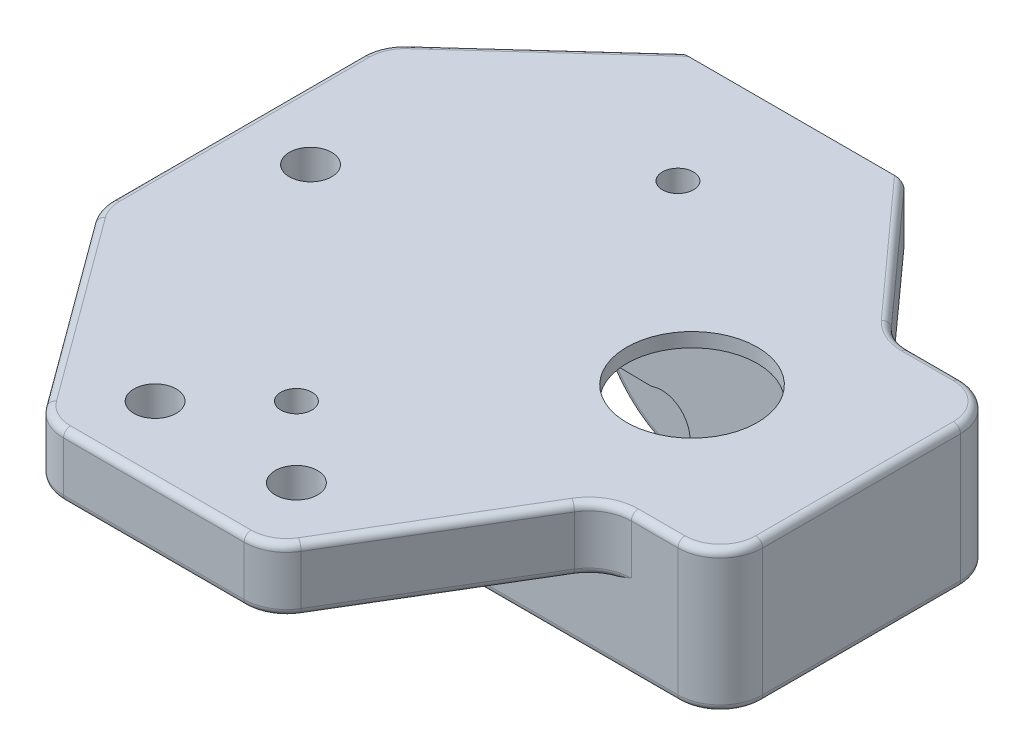
from build123d import *

# Parameters (mm, degrees)
BOSS_EXTRUDE1_DEPTH     = 4.5
SKETCH2_W               = 34
SKETCH2_H               = 20
BOSS_EXTRUDE2_DEPTH     = 5.5
SKETCH3_R               = 4.621656239
CUT_EXTRUDE1_DEPTH      = 15.5
SKETCH4_W               = 22.4
SKETCH4_H               = 12.6
CUT_EXTRUDE2_DEPTH      = 9
SKETCH5_R               = 1.5
CUT_EXTRUDE3_DEPTH      = 9
SKETCH6_R               = 1
CUT_EXTRUDE4_DEPTH      = 9
SKETCH7_R               = 1.5
CUT_EXTRUDE5_DEPTH      = 19
SKETCH8_W               = 16
SKETCH8_H               = 5
BOSS_EXTRUDE3_DEPTH     = 15
SKETCH9_R               = 0.75
CUT_EXTRUDE6_DEPTH      = 6
SKETCH10_R              = 2
CUT_EXTRUDE7_DEPTH      = 36
FILLET1_R               = 3
FILLET2_R               = 8
FILLET3_R               = 2
CUT_EXTRUDE8_DEPTH      = 30
CUT_EXTRUDE9_DEPTH      = 10
CUT_EXTRUDE9_DEPTH_BACK = 10
SKETCH12_R              = 1.1
FILLET4_R               = 0.5
SKETCH13_R              = 2
CUT_EXTRUDE10_DEPTH     = 10


# Some blends are built 0.0001 mm under size
with BuildPart() as part:
    # Sketch1 → Boss-Extrude1 (new body)
    with BuildSketch(Plane(origin=(0, 0, 0), x_dir=(1, 0, 0), z_dir=(0, 1, 0))):
        Polygon((0, 0), (16, 0), (25, 15), (33, 15), (33, 35), (25, 35), (16, 45), (0, 45), (-11, 35), (-11, 15), align=None)
    extrude(amount=BOSS_EXTRUDE1_DEPTH)

    # Sketch2 → Boss-Extrude2 (add)
    with BuildSketch(Plane(origin=(0, 0, 0), x_dir=(-1, 0, 0), z_dir=(0, -1, 0))):
        with Locations((-16, 25)):
            Rectangle(SKETCH2_W, SKETCH2_H)
    extrude(amount=BOSS_EXTRUDE2_DEPTH)

    # Sketch3 → Cut-Extrude1 (cut)
    with BuildSketch(Plane(origin=(0, -5.5, 0), x_dir=(-1, 0, 0), z_dir=(0, -1, 0))):
        with Locations(Location((-21, 25, 0), (0, 0, 90))):
            Circle(SKETCH3_R)
    extrude(amount=-CUT_EXTRUDE1_DEPTH, mode=Mode.SUBTRACT)

    # Sketch4 → Cut-Extrude2 (cut)
    with BuildSketch(Plane.XZ.offset(5.5)):
        with Locations((15.8, -24.8)):
            Rectangle(SKETCH4_W, SKETCH4_H)
    extrude(amount=-CUT_EXTRUDE2_DEPTH, mode=Mode.SUBTRACT)

    # Sketch5 → Cut-Extrude3 (cut)
    with BuildSketch(Plane(origin=(0, 0, 0), x_dir=(-1, 0, 0), z_dir=(0, -1, 0))):
        with Locations(Location((-3, 5, 0), (0, 0, 90))):
            Circle(SKETCH5_R)
        with Locations(Location((-13, 5, 0), (0, 0, 90))):
            Circle(SKETCH5_R)
    extrude(amount=-CUT_EXTRUDE3_DEPTH, mode=Mode.SUBTRACT)

    # Sketch6 → Cut-Extrude4 (cut)
    with BuildSketch(Plane(origin=(0, -5.5, 0), x_dir=(-1, 0, 0), z_dir=(0, -1, 0))):
        with Locations(Location((-2, 25, 0), (0, 0, 90))):
            Circle(SKETCH6_R)
        with Locations(Location((-30, 25, 0), (0, 0, 90))):
            Circle(SKETCH6_R)
    extrude(amount=-CUT_EXTRUDE4_DEPTH, mode=Mode.SUBTRACT)

    # Sketch7 → Cut-Extrude5 (cut)
    with BuildSketch(Plane(origin=(0, 0, 0), x_dir=(-1, 0, 0), z_dir=(0, -1, 0))):
        with Locations(Location((6, 25, 0), (0, 0, 90))):
            Circle(SKETCH7_R)
    extrude(amount=-CUT_EXTRUDE5_DEPTH, mode=Mode.SUBTRACT)

    # Sketch8 → Boss-Extrude3 (add)
    with BuildSketch(Plane(origin=(0, 0, 0), x_dir=(-1, 0, 0), z_dir=(0, -1, 0))):
        with Locations((-8, 41.5)):
            Rectangle(SKETCH8_W, SKETCH8_H)
    extrude(amount=BOSS_EXTRUDE3_DEPTH)

    # Sketch9 → Cut-Extrude6 (cut)
    with BuildSketch(Plane(origin=(0, 0, -45), x_dir=(-1, 0, 0), z_dir=(0, 0, -1))):
        with Locations((-12.75, -5)):
            Circle(SKETCH9_R)
        with Locations((-3.25, -5)):
            Circle(SKETCH9_R)
    extrude(amount=-CUT_EXTRUDE6_DEPTH, mode=Mode.SUBTRACT)

    # Sketch10 → Cut-Extrude7 (cut)
    with BuildSketch(Plane(origin=(0, 0, -45), x_dir=(-1, 0, 0), z_dir=(0, 0, -1))):
        with Locations((-8, -5)):
            Circle(SKETCH10_R)
    extrude(amount=-CUT_EXTRUDE7_DEPTH, mode=Mode.SUBTRACT)

    # Fillet1
    fillet1_edges = [part.edges().sort_by_distance(p)[0] for p in [
        (-11, 2.25, -15),
        (-11, 2.25, -35),
        (25, 2.25, -35),
        (33, -0.5, -35),
        (33, -0.5, -15),
        (25, 2.25, -15),
        (16, 2.25, 0),
        (0, 2.25, 0),
        (-1, -2.75, -15),
        (-1, -2.75, -35),
    ]]
    fillet(fillet1_edges, radius=FILLET1_R)

    # Fillet2
    fillet2_edges = [part.edges().sort_by_distance(p)[0] for p in [
        (16, -15, -41.5),
        (0, -15, -41.5),
    ]]
    fillet(fillet2_edges, radius=FILLET2_R - 0.0001)  # a hair under: the kernel refuses the full size

    # Fillet3
    fillet3_edges = [part.edges().sort_by_distance(p)[0] for p in [
        (8, 0, -39),
    ]]
    fillet(fillet3_edges, radius=FILLET3_R)

    # Sketch11 → Cut-Extrude8 (cut)
    with BuildSketch(Plane.XY.offset(-39)):
        with BuildLine():
            Line((3.25, -3), (12.041449094, -3.129717772))
            ThreePointArc((12.041449094, -3.129717772), (14.75, -5), (12.041449094, -6.870282228))
            Line((12.041449094, -6.870282228), (3.25, -7))
            ThreePointArc((3.25, -7), (1.25, -5), (3.25, -3))
        make_face()
    extrude(amount=CUT_EXTRUDE8_DEPTH, mode=Mode.SUBTRACT)

    # Sketch12 → Cut-Extrude9 (cut, two sides: drawn at the far end of the back side and taken through both)
    with BuildSketch(Plane(origin=(0, 0, 0), x_dir=(-1, 0, 0), z_dir=(0, -1, 0)).offset(-CUT_EXTRUDE9_DEPTH_BACK)):
        with Locations(Location((-8, 37, 0), (0, 0, 180))):
            Circle(SKETCH12_R)
        with Locations(Location((-8, 10, 0), (0, 0, 90))):
            Circle(SKETCH12_R)
    extrude(amount=CUT_EXTRUDE9_DEPTH + CUT_EXTRUDE9_DEPTH_BACK, mode=Mode.SUBTRACT)

    # Fillet4
    # the kernel refuses this fillet: 0.5 mm, written as the material it takes off along each edge
    with BuildSketch(Plane(origin=(0.924925092, 4.5, -45.840840992), x_dir=(0, -1, 0), z_dir=(-0.7399400733959434, 0, 0.6726727939963129)), Plane(origin=(0.924925092, 0, -45.840840992), x_dir=(0.6726727939963129, 0, 0.7399400733959434), z_dir=(-0.7399400733959434, 0, 0.6726727939963129))) as fillet4_piece_1:
        with BuildLine():
            CenterArc((FILLET4_R, FILLET4_R), FILLET4_R, 180, 90)
            Line((0, FILLET4_R), (0, 0))
            Line((0, 0), (FILLET4_R, 0))
        make_face()
    extrude(amount=14.788959089, mode=Mode.SUBTRACT)
    with BuildSketch(Plane(origin=(-8, 4.5, -33.672890342), x_dir=(-0.6726727939963135, 0, -0.7399400733959428), z_dir=(0.7399400733959428, 0, -0.6726727939963135))) as fillet4_piece_2:
        with BuildLine():
            CenterArc((3 - FILLET4_R, -FILLET4_R), FILLET4_R, 0, 90)
            Line((3 - FILLET4_R, 0), (3, 0))
            Line((3, 0), (3, -FILLET4_R))
        make_face()
    revolve(axis=Axis((-8, 4.5, -33.672890342), (0, 1, 0)), revolution_arc=47.726310994, mode=Mode.SUBTRACT)
    with BuildSketch(Plane(origin=(-11, 4.5, -33.672890342), x_dir=(0, -1, 0), z_dir=(0, 0, 1)), Plane(origin=(-11, 0, -33.672890342), x_dir=(1, 0, 0), z_dir=(0, 0, 1))) as fillet4_piece_3:
        with BuildLine():
            CenterArc((FILLET4_R, FILLET4_R), FILLET4_R, 180, 90)
            Line((0, FILLET4_R), (0, 0))
            Line((0, 0), (FILLET4_R, 0))
        make_face()
    extrude(amount=17.690778913, mode=Mode.SUBTRACT)
    with BuildSketch(Plane(origin=(-8, 4.5, -15.982111428), x_dir=(-1, 0, 0), z_dir=(0, 0, -1))) as fillet4_piece_4:
        with BuildLine():
            CenterArc((3 - FILLET4_R, -FILLET4_R), FILLET4_R, 0, 90)
            Line((3 - FILLET4_R, 0), (3, 0))
            Line((3, 0), (3, -FILLET4_R))
        make_face()
    revolve(axis=Axis((-8, 4.5, -15.982111428), (0, 1, 0)), revolution_arc=36.253837737, mode=Mode.SUBTRACT)
    with BuildSketch(Plane(origin=(-10.419214988, 4.5, -14.208020438), x_dir=(0, -1, 0), z_dir=(0.5913636636275179, 0, 0.8064049958557052)), Plane(origin=(-10.419214988, 0, -14.208020438), x_dir=(0.8064049958557051, 0, -0.5913636636275179), z_dir=(0.5913636636275179, 0, 0.8064049958557052))) as fillet4_piece_5:
        with BuildLine():
            CenterArc((FILLET4_R, FILLET4_R), FILLET4_R, 180, 90)
            Line((0, FILLET4_R), (0, 0))
            Line((0, 0), (FILLET4_R, 0))
        make_face()
    extrude(amount=16.098748762, mode=Mode.SUBTRACT)
    with BuildSketch(Plane(origin=(1.520215048, 4.5, -3), x_dir=(0, 0, 1), z_dir=(1, 0, 0))) as fillet4_piece_6:
        with BuildLine():
            CenterArc((3 - FILLET4_R, FILLET4_R), FILLET4_R, 270, 90)
            Line((3 - FILLET4_R, 0), (3, 0))
            Line((3, 0), (3, FILLET4_R))
        make_face()
    revolve(axis=Axis((1.520215048, 4.5, -3), (0, -1, 0)), revolution_arc=53.746162263, mode=Mode.SUBTRACT)
    with BuildSketch(Plane(origin=(1.520215048, 4.5, 0), x_dir=(0, -1, 0), z_dir=(1, 0, 0)), Plane(origin=(1.520215048, 0, 0), x_dir=(0, 0, -1), z_dir=(1, 0, 0))) as fillet4_piece_7:
        with BuildLine():
            CenterArc((FILLET4_R, FILLET4_R), FILLET4_R, 180, 90)
            Line((0, FILLET4_R), (0, 0))
            Line((0, 0), (FILLET4_R, 0))
        make_face()
    extrude(amount=12.781213816, mode=Mode.SUBTRACT)
    with BuildSketch(Plane(origin=(14.301428863, 4.5, -3), x_dir=(0, 0, 1), z_dir=(-1, 0, 0))) as fillet4_piece_8:
        with BuildLine():
            CenterArc((3 - FILLET4_R, -FILLET4_R), FILLET4_R, 0, 90)
            Line((3 - FILLET4_R, 0), (3, 0))
            Line((3, 0), (3, -FILLET4_R))
        make_face()
    revolve(axis=Axis((14.301428863, 4.5, -3), (0, 1, 0)), revolution_arc=59.036243468, mode=Mode.SUBTRACT)
    with BuildSketch(Plane(origin=(16.87390764, 4.5, -1.456512734), x_dir=(0, -1, 0), z_dir=(0.5144957554275266, 0, -0.8574929257125442)), Plane(origin=(16.87390764, 0, -1.456512734), x_dir=(-0.8574929257125441, 0, -0.5144957554275266), z_dir=(0.5144957554275266, 0, -0.8574929257125442))) as fillet4_piece_9:
        with BuildLine():
            CenterArc((FILLET4_R, FILLET4_R), FILLET4_R, 180, 90)
            Line((0, FILLET4_R), (0, 0))
            Line((0, 0), (FILLET4_R, 0))
        make_face()
    extrude(amount=14.095713411, mode=Mode.SUBTRACT)
    with BuildSketch(Plane(origin=(26.698571137, 4.5, -12), x_dir=(0, 0, -1), z_dir=(1, 0, 0))) as fillet4_piece_10:
        with BuildLine():
            CenterArc((3 + FILLET4_R, -FILLET4_R), FILLET4_R, 90, 90)
            Line((3 + FILLET4_R, 0), (3, 0))
            Line((3, 0), (3, -FILLET4_R))
        make_face()
    revolve(axis=Axis((26.698571137, 4.5, -12), (0, 1, 0)), revolution_arc=59.036243468, mode=Mode.SUBTRACT)
    with BuildSketch(Plane(origin=(26.698571137, 4.5, -15), x_dir=(0, -1, 0), z_dir=(1, 0, 0))) as fillet4_piece_11:
        with BuildLine():
            CenterArc((FILLET4_R, FILLET4_R), FILLET4_R, 180, 90)
            Line((0, FILLET4_R), (0, 0))
            Line((0, 0), (FILLET4_R, 0))
        make_face()
    extrude(amount=3.301428863, mode=Mode.SUBTRACT)
    with BuildSketch(Plane(origin=(30, 4.5, -18), x_dir=(1, 0, 0), z_dir=(0, 0, -1))) as fillet4_piece_12:
        with BuildLine():
            CenterArc((3 - FILLET4_R, FILLET4_R), FILLET4_R, 270, 90)
            Line((3, FILLET4_R), (3, 0))
            Line((3, 0), (3 - FILLET4_R, 0))
        make_face()
    revolve(axis=Axis((30, 4.5, -18), (0, -1, 0)), revolution_arc=90, mode=Mode.SUBTRACT)
    with BuildSketch(Plane(origin=(33, 4.5, -18), x_dir=(-1, 0, 0), z_dir=(0, 0, -1)), Plane(origin=(33, -5.5, -32), x_dir=(-1, 0, 0), z_dir=(0, 0, 1))) as fillet4_piece_13:
        with BuildLine():
            CenterArc((FILLET4_R, -FILLET4_R), FILLET4_R, 90, 90)
            Line((0, -FILLET4_R), (0, 0))
            Line((0, 0), (FILLET4_R, 0))
        make_face()
    extrude(amount=14, mode=Mode.SUBTRACT)
    with BuildSketch(Plane(origin=(30, 4.5, -32), x_dir=(0, 0, -1), z_dir=(-1, 0, 0))) as fillet4_piece_14:
        with BuildLine():
            CenterArc((3 - FILLET4_R, FILLET4_R), FILLET4_R, 270, 90)
            Line((3, FILLET4_R), (3, 0))
            Line((3, 0), (3 - FILLET4_R, 0))
        make_face()
    revolve(axis=Axis((30, 4.5, -32), (0, -1, 0)), revolution_arc=90, mode=Mode.SUBTRACT)
    with BuildSketch(Plane(origin=(30, 4.5, -35), x_dir=(0, -1, 0), z_dir=(-1, 0, 0))) as fillet4_piece_15:
        with BuildLine():
            CenterArc((FILLET4_R, FILLET4_R), FILLET4_R, 180, 90)
            Line((0, FILLET4_R), (0, 0))
            Line((0, 0), (FILLET4_R, 0))
        make_face()
    extrude(amount=3.663912786, mode=Mode.SUBTRACT)
    with BuildSketch(Plane(origin=(26.336087214, 4.5, -38), x_dir=(-0.7432941462471643, 0, 0.6689647316224518), z_dir=(-0.6689647316224518, 0, -0.7432941462471643))) as fillet4_piece_16:
        with BuildLine():
            CenterArc((3 + FILLET4_R, -FILLET4_R), FILLET4_R, 90, 90)
            Line((3 + FILLET4_R, 0), (3, 0))
            Line((3, 0), (3, -FILLET4_R))
        make_face()
    revolve(axis=Axis((26.336087214, 4.5, -38), (0, 1, 0)), revolution_arc=48.012787504, mode=Mode.SUBTRACT)
    with BuildSketch(Plane(origin=(24.106204775, 4.5, -35.993105805), x_dir=(0, -1, 0), z_dir=(-0.6689647316224511, 0, -0.7432941462471652)), Plane(origin=(24.106204775, 0, -35.993105805), x_dir=(-0.7432941462471652, 0, 0.6689647316224511), z_dir=(-0.6689647316224511, 0, -0.7432941462471652))) as fillet4_piece_17:
        with BuildLine():
            CenterArc((FILLET4_R, FILLET4_R), FILLET4_R, 180, 90)
            Line((0, FILLET4_R), (0, 0))
            Line((0, 0), (FILLET4_R, 0))
        make_face()
    extrude(amount=13.367536833, mode=Mode.SUBTRACT)
    with BuildSketch(Plane(origin=(-8, 0, -33.672890342), x_dir=(-0.6726727939963135, 0, -0.7399400733959428), z_dir=(0.7399400733959428, 0, -0.6726727939963135))) as fillet4_piece_18:
        with BuildLine():
            CenterArc((3 - FILLET4_R, FILLET4_R), FILLET4_R, 270, 90)
            Line((3, FILLET4_R), (3, 0))
            Line((3, 0), (3 - FILLET4_R, 0))
        make_face()
    revolve(axis=Axis((-8, 0, -33.672890342), (0, 1, 0)), revolution_arc=47.726310994, mode=Mode.SUBTRACT)
    with BuildSketch(Plane(origin=(-8, 0, -15.982111428), x_dir=(-1, 0, 0), z_dir=(0, 0, -1))) as fillet4_piece_19:
        with BuildLine():
            CenterArc((3 - FILLET4_R, FILLET4_R), FILLET4_R, 270, 90)
            Line((3, FILLET4_R), (3, 0))
            Line((3, 0), (3 - FILLET4_R, 0))
        make_face()
    revolve(axis=Axis((-8, 0, -15.982111428), (0, 1, 0)), revolution_arc=36.253837737, mode=Mode.SUBTRACT)
    with BuildSketch(Plane(origin=(26.698571137, 0, -12), x_dir=(0.40478040995595427, 0, -0.9144139214359597), z_dir=(0.9144139214359597, 0, 0.40478040995595427))) as fillet4_piece_20_section:
        with BuildLine():
            CenterArc((3 + FILLET4_R, FILLET4_R), FILLET4_R, 180, 90)
            Line((3, FILLET4_R), (3, 0))
            Line((3, 0), (3 + FILLET4_R, 0))
        make_face()
    fillet4_piece_20 = revolve(axis=Axis((26.698571137, 0, -12), (0, 1, 0)), revolution_arc=82.9136107, mode=Mode.PRIVATE)
    fillet4_piece_20 = split(fillet4_piece_20, bisect_by=Plane(origin=(25.210476334, 0.134584404, -15), z_dir=(0, 0, 1)), keep=Keep.TOP, mode=Mode.PRIVATE)
    add(fillet4_piece_20, mode=Mode.SUBTRACT)
    with BuildSketch(Plane(origin=(14.301428863, 0, -3), x_dir=(0, 0, 1), z_dir=(-1, 0, 0))) as fillet4_piece_21:
        with BuildLine():
            CenterArc((3 - FILLET4_R, FILLET4_R), FILLET4_R, 270, 90)
            Line((3, FILLET4_R), (3, 0))
            Line((3, 0), (3 - FILLET4_R, 0))
        make_face()
    revolve(axis=Axis((14.301428863, 0, -3), (0, 1, 0)), revolution_arc=59.036243468, mode=Mode.SUBTRACT)
    with BuildSketch(Plane(origin=(1.520215048, 0, -3), x_dir=(0, 0, 1), z_dir=(1, 0, 0))) as fillet4_piece_22:
        with BuildLine():
            CenterArc((3 - FILLET4_R, -FILLET4_R), FILLET4_R, 0, 90)
            Line((3, -FILLET4_R), (3, 0))
            Line((3, 0), (3 - FILLET4_R, 0))
        make_face()
    revolve(axis=Axis((1.520215048, 0, -3), (0, -1, 0)), revolution_arc=53.746162263, mode=Mode.SUBTRACT)
    with BuildSketch(Plane(origin=(0, -2, -37), x_dir=(0, 0, -1), z_dir=(0, -1, 0))) as fillet4_piece_23_section:
        with BuildLine():
            CenterArc((2 + FILLET4_R, FILLET4_R), FILLET4_R, 180, 90)
            Line((2, FILLET4_R), (2, 0))
            Line((2, 0), (2 + FILLET4_R, 0))
        make_face()
    fillet4_piece_23 = revolve(axis=Axis((0, -2, -37), (1, 0, 0)), revolution_arc=125.824247309, mode=Mode.PRIVATE)
    fillet4_piece_23 = split(fillet4_piece_23, bisect_by=Plane(origin=(0.082392876, 0, -39.104829239), z_dir=(0, -1, 0)), keep=Keep.TOP, mode=Mode.PRIVATE)
    add(fillet4_piece_23, mode=Mode.SUBTRACT)
    with BuildSketch(Plane(origin=(0, -2, -39), x_dir=(1, 0, 0), z_dir=(0, -1, 0))) as fillet4_piece_24:
        with BuildLine():
            CenterArc((FILLET4_R, -FILLET4_R), FILLET4_R, 90, 90)
            Line((0, -FILLET4_R), (0, 0))
            Line((0, 0), (FILLET4_R, 0))
        make_face()
    extrude(amount=5.0001, mode=Mode.SUBTRACT)
    with BuildSketch(Plane(origin=(7.9999, -7.0001, -39), x_dir=(0, -1, 0), z_dir=(1, 0, 0))) as fillet4_piece_25:
        with BuildLine():
            CenterArc((7.9999 - FILLET4_R, FILLET4_R), FILLET4_R, 270, 90)
            Line((7.9999, FILLET4_R), (7.9999, 0))
            Line((7.9999, 0), (7.9999 - FILLET4_R, 0))
        make_face()
    revolve(axis=Axis((7.9999, -7.0001, -39), (0, 0, -1)), revolution_arc=90, mode=Mode.SUBTRACT)
    with BuildSketch(Plane(origin=(16, -2, -37), x_dir=(0, 0, -1), z_dir=(0, -1, 0))) as fillet4_piece_26_section:
        with BuildLine():
            CenterArc((2 + FILLET4_R, -FILLET4_R), FILLET4_R, 90, 90)
            Line((2, -FILLET4_R), (2, 0))
            Line((2, 0), (2 + FILLET4_R, 0))
        make_face()
    fillet4_piece_26 = revolve(axis=Axis((16, -2, -37), (1, 0, 0)), revolution_arc=125.824247309, mode=Mode.PRIVATE)
    fillet4_piece_26 = split(fillet4_piece_26, bisect_by=Plane(origin=(15.917607109, 0, -39.104829231), z_dir=(0, -1, 0)), keep=Keep.TOP, mode=Mode.PRIVATE)
    add(fillet4_piece_26, mode=Mode.SUBTRACT)
    with BuildSketch(Plane(origin=(16, -2, -39), x_dir=(-1, 0, 0), z_dir=(0, -1, 0))) as fillet4_piece_27:
        with BuildLine():
            CenterArc((FILLET4_R, FILLET4_R), FILLET4_R, 180, 90)
            Line((0, FILLET4_R), (0, 0))
            Line((0, 0), (FILLET4_R, 0))
        make_face()
    extrude(amount=5.0001, mode=Mode.SUBTRACT)
    with BuildSketch(Plane(origin=(2, -5.5, -18), x_dir=(-1, 0, 0), z_dir=(0, 0, -1))) as fillet4_piece_28:
        with BuildLine():
            CenterArc((3 - FILLET4_R, FILLET4_R), FILLET4_R, 270, 90)
            Line((3 - FILLET4_R, 0), (3, 0))
            Line((3, 0), (3, FILLET4_R))
        make_face()
    revolve(axis=Axis((2, -5.5, -18), (0, 1, 0)), revolution_arc=100.651987503, mode=Mode.SUBTRACT)
    with BuildSketch(Plane(origin=(2, -5.5, -32), x_dir=(-1, 0, 0), z_dir=(0, 0, 1))) as fillet4_piece_29:
        with BuildLine():
            CenterArc((3 - FILLET4_R, -FILLET4_R), FILLET4_R, 0, 90)
            Line((3 - FILLET4_R, 0), (3, 0))
            Line((3, 0), (3, -FILLET4_R))
        make_face()
    revolve(axis=Axis((2, -5.5, -32), (0, -1, 0)), revolution_arc=100.651987503, mode=Mode.SUBTRACT)
    with BuildSketch(Plane(origin=(13.436491673, -5.5, -35), x_dir=(0, 1, 0), z_dir=(1, 0, 0)), Plane(origin=(30, -5.5, -15), x_dir=(0, 1, 0), z_dir=(-1, 0, 0))) as fillet4_piece_30:
        with BuildLine():
            CenterArc((FILLET4_R, FILLET4_R), FILLET4_R, 180, 90)
            Line((0, FILLET4_R), (0, 0))
            Line((0, 0), (FILLET4_R, 0))
        make_face()
    extrude(amount=16.563508327, mode=Mode.SUBTRACT)
    with BuildSketch(Plane(origin=(30, -5.5, -32), x_dir=(0, 0, -1), z_dir=(-1, 0, 0))) as fillet4_piece_31:
        with BuildLine():
            CenterArc((3 - FILLET4_R, -FILLET4_R), FILLET4_R, 0, 90)
            Line((3, -FILLET4_R), (3, 0))
            Line((3, 0), (3 - FILLET4_R, 0))
        make_face()
    revolve(axis=Axis((30, -5.5, -32), (0, -1, 0)), revolution_arc=90, mode=Mode.SUBTRACT)
    with BuildSketch(Plane(origin=(30, -5.5, -18), x_dir=(1, 0, 0), z_dir=(0, 0, -1))) as fillet4_piece_32:
        with BuildLine():
            CenterArc((3 - FILLET4_R, -FILLET4_R), FILLET4_R, 0, 90)
            Line((3, -FILLET4_R), (3, 0))
            Line((3, 0), (3 - FILLET4_R, 0))
        make_face()
    revolve(axis=Axis((30, -5.5, -18), (0, -1, 0)), revolution_arc=90, mode=Mode.SUBTRACT)
    with BuildSketch(Plane(origin=(8.0001, -7.0001, -39), x_dir=(0, -1, 0), z_dir=(-1, 0, 0))) as fillet4_piece_33:
        with BuildLine():
            CenterArc((7.9999 - FILLET4_R, -FILLET4_R), FILLET4_R, 0, 90)
            Line((7.9999, -FILLET4_R), (7.9999, 0))
            Line((7.9999, 0), (7.9999 - FILLET4_R, 0))
        make_face()
    revolve(axis=Axis((8.0001, -7.0001, -39), (0, 0, 1)), revolution_arc=90, mode=Mode.SUBTRACT)
    with BuildSketch(Plane(origin=(-1, -5.5, -18), x_dir=(0, 1, 0), z_dir=(0, 0, -1))) as fillet4_piece_34:
        with BuildLine():
            CenterArc((FILLET4_R, FILLET4_R), FILLET4_R, 180, 90)
            Line((0, FILLET4_R), (0, 0))
            Line((0, 0), (FILLET4_R, 0))
        make_face()
    extrude(amount=14, mode=Mode.SUBTRACT)
    with BuildSketch(Plane(origin=(26.336087214, 0, -38), x_dir=(-0.7432941462471643, 0, 0.6689647316224518), z_dir=(-0.6689647316224518, 0, -0.7432941462471643))) as fillet4_piece_35_section:
        with BuildLine():
            CenterArc((3 + FILLET4_R, FILLET4_R), FILLET4_R, 180, 90)
            Line((3, FILLET4_R), (3, 0))
            Line((3, 0), (3 + FILLET4_R, 0))
        make_face()
    fillet4_piece_35 = revolve(axis=Axis((26.336087214, 0, -38), (0, 1, 0)), revolution_arc=71.888757716, mode=Mode.PRIVATE)
    fillet4_piece_35 = split(fillet4_piece_35, bisect_by=Plane(origin=(24.329849647, 0.084230131, -35), z_dir=(0, 0, -1)), keep=Keep.TOP, mode=Mode.PRIVATE)
    add(fillet4_piece_35, mode=Mode.SUBTRACT)
    with BuildSketch(Plane(origin=(8.0001, -15, -39), x_dir=(0, 1, 0), z_dir=(-1, 0, 0))) as fillet4_piece_36:
        with BuildLine():
            CenterArc((FILLET4_R, FILLET4_R), FILLET4_R, 180, 90)
            Line((0, FILLET4_R), (0, 0))
            Line((0, 0), (FILLET4_R, 0))
        make_face()
    extrude(amount=0.0002, mode=Mode.SUBTRACT)

    # Sketch13 → Cut-Extrude10 (cut)
    with BuildSketch(Plane(origin=(0, 0, 0), x_dir=(-1, 0, 0), z_dir=(0, -1, 0))):
        with Locations((-8, 37)):
            Circle(SKETCH13_R)
    extrude(amount=CUT_EXTRUDE10_DEPTH, mode=Mode.SUBTRACT)


solid = part.part
